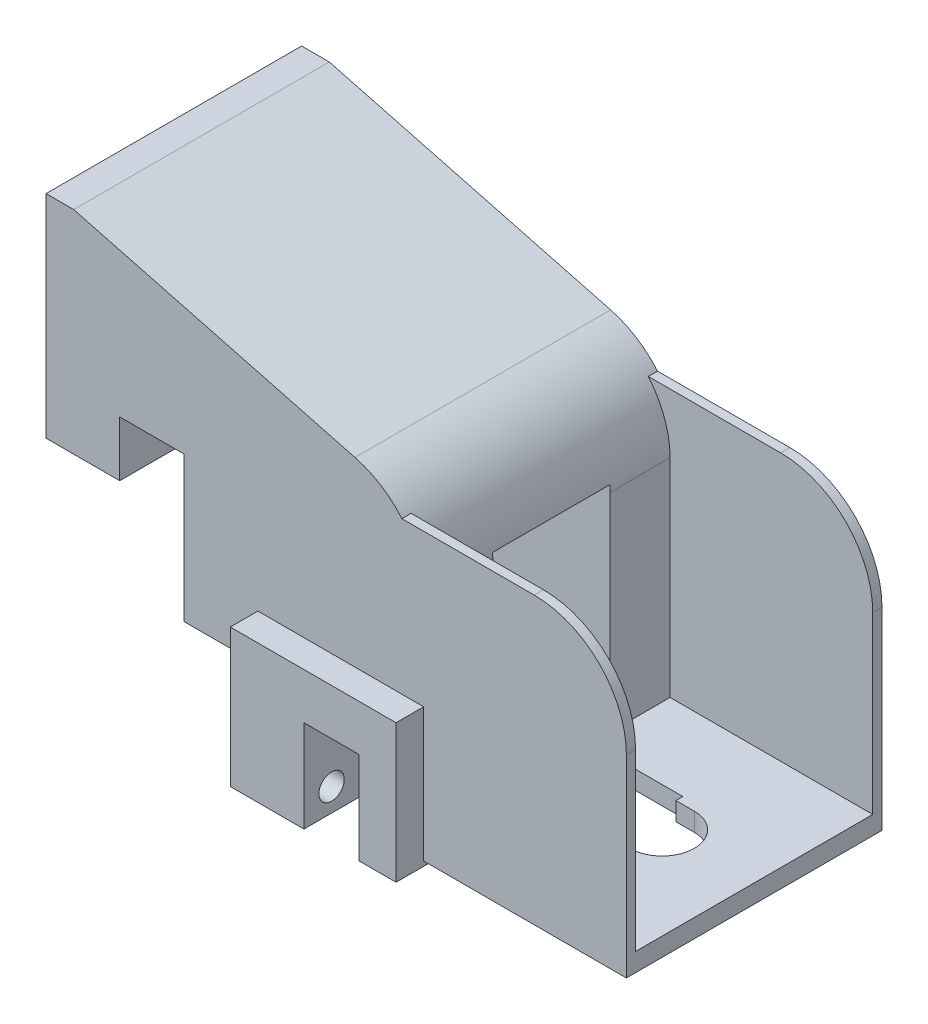
from build123d import *

# Parameters (mm, degrees)
SKETCH1_W           = 48
SKETCH1_H           = 27.75
BOSS_EXTRUDE1_DEPTH = 31
CUT_EXTRUDE1_DEPTH  = 36
SKETCH3_W           = 22
SKETCH3_H           = 25.75
CUT_EXTRUDE2_DEPTH  = 29
CUT_EXTRUDE3_DEPTH  = 45.957983893
BOSS_EXTRUDE2_START = -26
SKETCH5_W           = 27.75
SKETCH5_H           = 17
BOSS_EXTRUDE2_DEPTH = 41
SKETCH10_W          = 27.75
SKETCH10_H          = 23
BOSS_EXTRUDE4_DEPTH = 8
CHAMFER1_SIZE       = 38
CHAMFER1_SIZE2      = 10
FILLET1_R           = 10
SKETCH6_W           = 9
SKETCH6_H           = 9.5
CUT_EXTRUDE4_DEPTH  = 8
BOSS_EXTRUDE3_DEPTH = 18
SKETCH8_R           = 1.375
CUT_EXTRUDE5_DEPTH  = 17
SKETCH9_W           = 6
SKETCH9_H           = 10
CUT_EXTRUDE6_DEPTH  = 9


with BuildPart() as part:
    # Sketch1 → Boss-Extrude1 (new body)
    with BuildSketch(Plane(origin=(0, 0, 0), x_dir=(1, 0, 0), z_dir=(0, 1, 0))):
        with Locations((6.698630137, 1.546232877)):
            Rectangle(SKETCH1_W, SKETCH1_H)
    extrude(amount=BOSS_EXTRUDE1_DEPTH)

    # Sketch2 → Cut-Extrude1 (cut)
    with BuildSketch(Plane.ZY.offset(17.301369863)):
        Polygon((-7.921232877, 25.25), (4.828767123, 25.25), (4.828767123, 2), (2.703767123, 2), (2.703767123, 0), (-5.796232877, 0), (-5.796232877, 2), (-7.921232877, 2), align=None)
    extrude(amount=-CUT_EXTRUDE1_DEPTH, mode=Mode.SUBTRACT)

    # Sketch3 → Cut-Extrude2 (cut)
    with BuildSketch(Plane(origin=(0, 31, 0), x_dir=(1, 0, 0), z_dir=(0, 1, 0))):
        with Locations((19.698630137, 1.546232877)):
            Rectangle(SKETCH3_W, SKETCH3_H)
    extrude(amount=-CUT_EXTRUDE2_DEPTH, mode=Mode.SUBTRACT)

    # Sketch4 → Cut-Extrude3 (cut, through all)
    with BuildSketch(Plane(origin=(0, 2, 0), x_dir=(1, 0, 0), z_dir=(0, 1, 0))):
        with BuildLine():
            Line((20.698630137, -1.953767123), (18.698630137, -1.953767123))
            ThreePointArc((18.698630137, -1.953767123), (15.198630137, 1.546232877), (18.698630137, 5.046232877))
            Line((18.698630137, 5.046232877), (20.698630137, 5.046232877))
            ThreePointArc((20.698630137, 5.046232877), (24.198630137, 1.546232877), (20.698630137, -1.953767123))
        make_face()
    extrude(amount=-CUT_EXTRUDE3_DEPTH, mode=Mode.SUBTRACT)

    # Sketch5 → Boss-Extrude2 (add)
    with BuildSketch(Plane.ZY.offset(17.301369863).offset(BOSS_EXTRUDE2_START)):
        with Locations((-1.546232877, 33.75)):
            Rectangle(SKETCH5_W, SKETCH5_H)
    extrude(amount=BOSS_EXTRUDE2_DEPTH)

    # Sketch10 → Boss-Extrude4 (add)
    with BuildSketch(Plane.ZY.offset(32.301369863)):
        with Locations((-1.546232877, 30.75)):
            Rectangle(SKETCH10_W, SKETCH10_H)
    extrude(amount=-BOSS_EXTRUDE4_DEPTH)

    # Chamfer1
    chamfer1_edges = [part.edges().sort_by_distance(p)[0] for p in [
        (8.698630137, 42.25, -1.546232877),
    ]]
    chamfer1_side = [part.faces().sort_by_distance(p)[0] for p in [
        (-11.801369863, 42.25, -1.546232877),
    ]]
    chamfer(chamfer1_edges, length=CHAMFER1_SIZE, length2=CHAMFER1_SIZE2, reference=chamfer1_side[0])

    # Fillet1
    # the kernel refuses this fillet: 10 mm, written as the material it takes off along each edge
    with BuildSketch(Plane(origin=(30.698630137, 31, -40.421232877), x_dir=(-1, 0, 0), z_dir=(0, 0, 1))) as fillet1_piece_1:
        with BuildLine():
            CenterArc((FILLET1_R, FILLET1_R), FILLET1_R, 180, 90)
            Line((0, FILLET1_R), (0, 0))
            Line((0, 0), (FILLET1_R, 0))
        make_face()
    extrude(amount=51, mode=Mode.SUBTRACT)
    with BuildSketch(Plane(origin=(30.698630137, 31, -13.671232877), x_dir=(0, -1, 0), z_dir=(0, 0, 1))) as fillet1_piece_2:
        with BuildLine():
            CenterArc((FILLET1_R, -FILLET1_R), FILLET1_R, 90, 90)
            Line((0, -FILLET1_R), (0, 0))
            Line((0, 0), (FILLET1_R, 0))
        make_face()
    extrude(amount=51, mode=Mode.SUBTRACT)
    with BuildSketch(Plane(origin=(8.698630137, 32.25, -34.693446961), x_dir=(-0.9670745372626461, 0.25449329927964454, 0), z_dir=(0, 0, 1))) as fillet1_piece_3_section:
        with BuildLine():
            CenterArc((FILLET1_R * 0.770888563389, FILLET1_R), FILLET1_R, 194.743562836, 75.256437164)
            Line((-FILLET1_R * 0.196185973874, FILLET1_R * 0.74550670072), (0, 0))
            Line((0, 0), (FILLET1_R * 0.770888563389, 0))
        make_face()
    fillet1_piece_3 = extrude(amount=66.294428169, mode=Mode.PRIVATE)
    fillet1_piece_3 = split(fillet1_piece_3, bisect_by=Plane(origin=(6.418470389, 31, -14.921232877), z_dir=(0, 1, 0)), keep=Keep.TOP, mode=Mode.PRIVATE)
    add(fillet1_piece_3, mode=Mode.SUBTRACT)
    with BuildSketch(Plane(origin=(8.698630137, 32.25, -34.693446961), x_dir=(-0.9670745372626461, 0.25449329927964454, 0), z_dir=(0, 0, 1))) as fillet1_piece_4_section:
        with BuildLine():
            CenterArc((FILLET1_R * 0.770888563389, FILLET1_R), FILLET1_R, 194.743562836, 75.256437164)
            Line((-FILLET1_R * 0.196185973874, FILLET1_R * 0.74550670072), (0, 0))
            Line((0, 0), (FILLET1_R * 0.770888563389, 0))
        make_face()
    fillet1_piece_4 = extrude(amount=66.294428169, mode=Mode.PRIVATE)
    fillet1_piece_4 = split(fillet1_piece_4, bisect_by=Plane(origin=(8.005221355, 29.431341636, -14.421232877), z_dir=(0, 0, 1)), keep=Keep.TOP, mode=Mode.PRIVATE)
    fillet1_piece_4 = split(fillet1_piece_4, bisect_by=Plane(origin=(8.005221355, 29.431341636, 11.328767123), z_dir=(0, 0, -1)), keep=Keep.TOP, mode=Mode.PRIVATE)
    add(fillet1_piece_4, mode=Mode.SUBTRACT)

    # Sketch6 → Cut-Extrude4 (cut)
    with BuildSketch(Plane.ZY.offset(17.301369863)):
        with Locations((10.828767123, 4.75)):
            Rectangle(SKETCH6_W, SKETCH6_H)
    cut_extrude4 = extrude(amount=-CUT_EXTRUDE4_DEPTH, mode=Mode.SUBTRACT)

    # Sketch7 → Boss-Extrude3 (add)
    with BuildSketch(Plane.ZY.offset(9.301369863)):
        Polygon((12.328767123, 0), (12.328767123, 9.5), (12.328767123, 14.5), (15.328767123, 14.5), (15.328767123, 9.5), (15.328767123, 0), (15.328767123, -0.5), (6.328767123, -0.5), (6.328767123, 0), align=None)
    boss_extrude3 = extrude(amount=-BOSS_EXTRUDE3_DEPTH)

    # Sketch8 → Cut-Extrude5 (cut)
    with BuildSketch(Plane.ZY.offset(9.301369863)):
        with Locations((12.328767123, 2)):
            Circle(SKETCH8_R)
    cut_extrude5 = extrude(amount=-CUT_EXTRUDE5_DEPTH, mode=Mode.SUBTRACT)

    # Sketch9 → Cut-Extrude6 (cut)
    with BuildSketch(Plane.XY.offset(15.328767123)):
        with Locations((1.698630137, 4.5)):
            Rectangle(SKETCH9_W, SKETCH9_H)
    cut_extrude6 = extrude(amount=-CUT_EXTRUDE6_DEPTH, mode=Mode.SUBTRACT)

    # Mirror1: Cut-Extrude4, Boss-Extrude3, Cut-Extrude5, Cut-Extrude6 across plane
    add(cut_extrude4.mirror(Plane.XY.offset(-1.546232877)), mode=Mode.SUBTRACT)
    add(boss_extrude3.mirror(Plane.XY.offset(-1.546232877)))
    add(cut_extrude5.mirror(Plane.XY.offset(-1.546232877)), mode=Mode.SUBTRACT)
    add(cut_extrude6.mirror(Plane.XY.offset(-1.546232877)), mode=Mode.SUBTRACT)


solid = part.part
